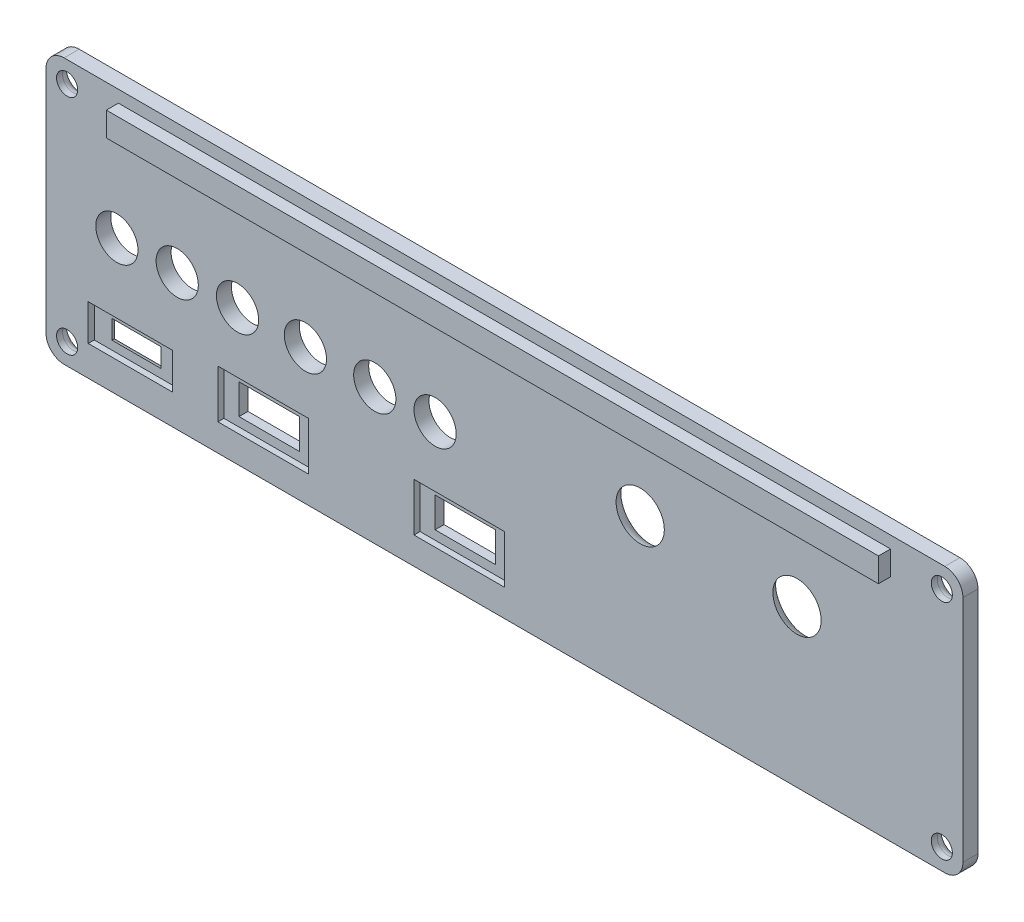
from build123d import *

# Parameters (mm, degrees)
SKETCH1_W            = 152
SKETCH1_H            = 44
MAIN_BODY_DEPTH      = 2.5
BODY_CORNERS_R       = 3
SKETCH2_R            = 1.75
MOUNTING_HOLES_DEPTH = 80.159648812
BOLT_HEADS_R         = 1.5
SKETCH3_R            = 3.5
SKETCH3_R_2          = 4
SKETCH3_W            = 10
SKETCH3_H            = 5
SKETCH3_W_2          = 8
SKETCH3_H_2          = 3
CONNECTORS_DEPTH     = 80.159648812
RF_CONN_FILLET_R     = 4
RF_CONN_FILLET_R_2   = 3
FAN_SW_FILLET_R      = 2
SKETCH6_W            = 138
SKETCH6_H            = 40
PAINT_SLOT_DEPTH     = 0.01
PAINT_SLOT_CORNERS_R = 5
SKETCH7_W            = 14
SKETCH7_H            = 6
SKETCH7_W_2          = 15
SKETCH7_H_2          = 8
BACK_CUT_DEPTH       = 1
SKETCH8_W            = 128
SKETCH8_H            = 4
BACK_SUPPORT_DEPTH   = 2
CONN_ARTWORK_DEPTH   = 0.01


with BuildPart() as part:
    # Sketch1 → main_body (new body)
    with BuildSketch(Plane.XY):
        Rectangle(SKETCH1_W, SKETCH1_H)
    extrude(amount=MAIN_BODY_DEPTH)

    # body_corners
    body_corners_edges = [part.edges().sort_by_distance(p)[0] for p in [
        (-76, 22, 1.25),
        (76, 22, 1.25),
        (76, -22, 1.25),
        (-76, -22, 1.25),
    ]]
    fillet(body_corners_edges, radius=BODY_CORNERS_R)

    # Sketch2 → mounting_holes (cut, through all)
    with BuildSketch(Plane.XY.offset(2.5)):
        with Locations((-72.5, -18.5)):
            Circle(SKETCH2_R)
        with Locations((72.5, 18.5)):
            Circle(SKETCH2_R)
        with Locations((72.5, -18.5)):
            Circle(SKETCH2_R)
        with Locations((-72.5, 18.5)):
            Circle(SKETCH2_R)
    extrude(amount=-MOUNTING_HOLES_DEPTH, mode=Mode.SUBTRACT)

    # bolt_heads
    bolt_heads_edges = [part.edges().sort_by_distance(p)[0] for p in [
        (-74.25, -18.5, 0),
        (70.75, 18.5, 0),
        (70.75, -18.5, 0),
        (-74.25, 18.5, 0),
    ]]
    fillet(bolt_heads_edges, radius=BOLT_HEADS_R)

    # Sketch3 → connectors (cut, through all)
    with BuildSketch(Plane.XY.offset(2.5)):
        with Locations((-11.5, 0.5)):
            Circle(SKETCH3_R)
        with Locations((-21.5, 0.5)):
            Circle(SKETCH3_R)
        with Locations((-33, 0.5)):
            Circle(SKETCH3_R)
        with Locations((-64.25, 0.5)):
            Circle(SKETCH3_R)
        with Locations((-44.25, 0.5)):
            Circle(SKETCH3_R)
        with Locations((-54.25, 0.5)):
            Circle(SKETCH3_R)
        with Locations((48.5, 4)):
            Circle(SKETCH3_R_2)
        with Locations((22.5, 4)):
            Circle(SKETCH3_R_2)
        with Locations((-40, -13.5)):
            Rectangle(SKETCH3_W, SKETCH3_H)
        with Locations((-62, -14)):
            Rectangle(SKETCH3_W_2, SKETCH3_H_2)
        with Locations((-7.5, -13.5)):
            Rectangle(SKETCH3_W, SKETCH3_H)
    extrude(amount=-CONNECTORS_DEPTH, mode=Mode.SUBTRACT)

    # rf_conn_fillet
    # the kernel refuses this fillet: 4, 3 mm, written as the material it takes off along each edge
    with BuildSketch(Plane(origin=(48.5, 4, 0), x_dir=(1, 0, 0), z_dir=(0, -1, 0))) as rf_conn_fillet_piece_1:
        with BuildLine():
            CenterArc((7.708099244, 4), RF_CONN_FILLET_R, 202.024312837, 67.975687163)
            Line((4, 2.5), (3.925838015, 2.47))
            ThreePointArc((3.925838015, 2.47), (3.92, 1.25), (3.92, 0))
            Line((3.92, 0), (4, -0.08))
            Line((4, -0.08), (7.708099244, -0.08))
            Line((7.708099244, -0.08), (7.708099244, 0))
        make_face()
    revolve(axis=Axis((48.5, 4, 0), (0, 0, 1)), mode=Mode.SUBTRACT)
    with BuildSketch(Plane(origin=(22.5, 4, 0), x_dir=(1, 0, 0), z_dir=(0, -1, 0))) as rf_conn_fillet_piece_2:
        with BuildLine():
            CenterArc((6.958039892, 3), RF_CONN_FILLET_R_2, 189.594068227, 80.405931773)
            Line((4, 2.5), (3.940839202, 2.49))
            ThreePointArc((3.940839202, 2.49), (3.94, 1.25), (3.94, 0))
            Line((3.94, 0), (4, -0.06))
            Line((4, -0.06), (6.958039892, -0.06))
            Line((6.958039892, -0.06), (6.958039892, 0))
        make_face()
    revolve(axis=Axis((22.5, 4, 0), (0, 0, 1)), mode=Mode.SUBTRACT)

    # fan_sw_fillet
    fan_sw_fillet_edges = [part.edges().sort_by_distance(p)[0] for p in [
        (-66, -14, 0),
        (-62, -12.5, 0),
        (-58, -14, 0),
        (-62, -15.5, 0),
    ]]
    fillet(fan_sw_fillet_edges, radius=FAN_SW_FILLET_R)

    # Sketch6 → paint_slot (cut)
    with BuildSketch(Plane(origin=(0, 0, 0), x_dir=(-1, 0, 0), z_dir=(0, 0, -1))):
        Rectangle(SKETCH6_W, SKETCH6_H)
    extrude(amount=-PAINT_SLOT_DEPTH, mode=Mode.SUBTRACT)

    # paint_slot_corners
    paint_slot_corners_edges = [part.edges().sort_by_distance(p)[0] for p in [
        (69, -20, 0.005),
        (69, 20, 0.005),
        (-69, 20, 0.005),
        (-69, -20, 0.005),
    ]]
    fillet(paint_slot_corners_edges, radius=PAINT_SLOT_CORNERS_R)

    # Sketch7 → back_cut (cut)
    with BuildSketch(Plane.XY.offset(2.5)):
        with Locations((-62, -14)):
            Rectangle(SKETCH7_W, SKETCH7_H)
        with Locations((-40, -13.5)):
            Rectangle(SKETCH7_W_2, SKETCH7_H_2)
        with Locations((-7.5, -13.5)):
            Rectangle(SKETCH7_W_2, SKETCH7_H_2)
    extrude(amount=-BACK_CUT_DEPTH, mode=Mode.SUBTRACT)

    # Sketch8 → back_support (add)
    with BuildSketch(Plane.XY.offset(2.5)):
        with Locations((0, 18)):
            Rectangle(SKETCH8_W, SKETCH8_H)
    extrude(amount=BACK_SUPPORT_DEPTH)

    # Sketch9 → conn_artwork (cut)
    with BuildSketch(Plane(origin=(0, 0, 0.01), x_dir=(-1, 0, 0), z_dir=(0, 0, -1))):
        Polygon((63.5, 9.25), (65, 9.25), (65, 6.75), (65.41, 6.75), (64.25, 5.776644428), (63.09, 6.75), (63.5, 6.75), align=None)
        Polygon((53.5, 8.276644428), (53.09, 8.276644428), (54.25, 9.25), (55.41, 8.276644428), (55, 8.276644428), (55, 5.776644428), (53.5, 5.776644428), align=None)
        with BuildLine():
            Line((43.5, 6.52202469), (43.5, 7.161592885))
            ThreePointArc((43.5, 7.161592885), (44.25, 7.911592885), (45, 7.161592885))
            Line((45, 7.161592885), (45, 6.52202469))
            ThreePointArc((45, 6.52202469), (44.25, 5.77202469), (43.5, 6.52202469))
        make_face()
        with BuildLine():
            Line((45.25, 9.25), (43.25, 9.25))
            Line((43.25, 9.25), (43.25, 9))
            Line((43.25, 9), (43.75, 9))
            Line((43.75, 9), (43.75, 8.745206654))
            ThreePointArc((43.75, 8.745206654), (42.937180788, 8.178617116), (42.591682554, 7.25))
            Line((42.591682554, 7.25), (42.934710965, 7.25))
            ThreePointArc((42.934710965, 7.25), (44.25, 8.479849712), (45.565289035, 7.25))
            Line((45.565289035, 7.25), (45.844582901, 7.25))
            ThreePointArc((45.844582901, 7.25), (45.51761804, 8.133011924), (44.75, 8.678336253))
            Line((44.75, 8.678336253), (44.75, 9))
            Line((44.75, 9), (45.25, 9))
            Line((45.25, 9), (45.25, 9.25))
        make_face()
    extrude(amount=-CONN_ARTWORK_DEPTH, mode=Mode.SUBTRACT)


solid = part.part
